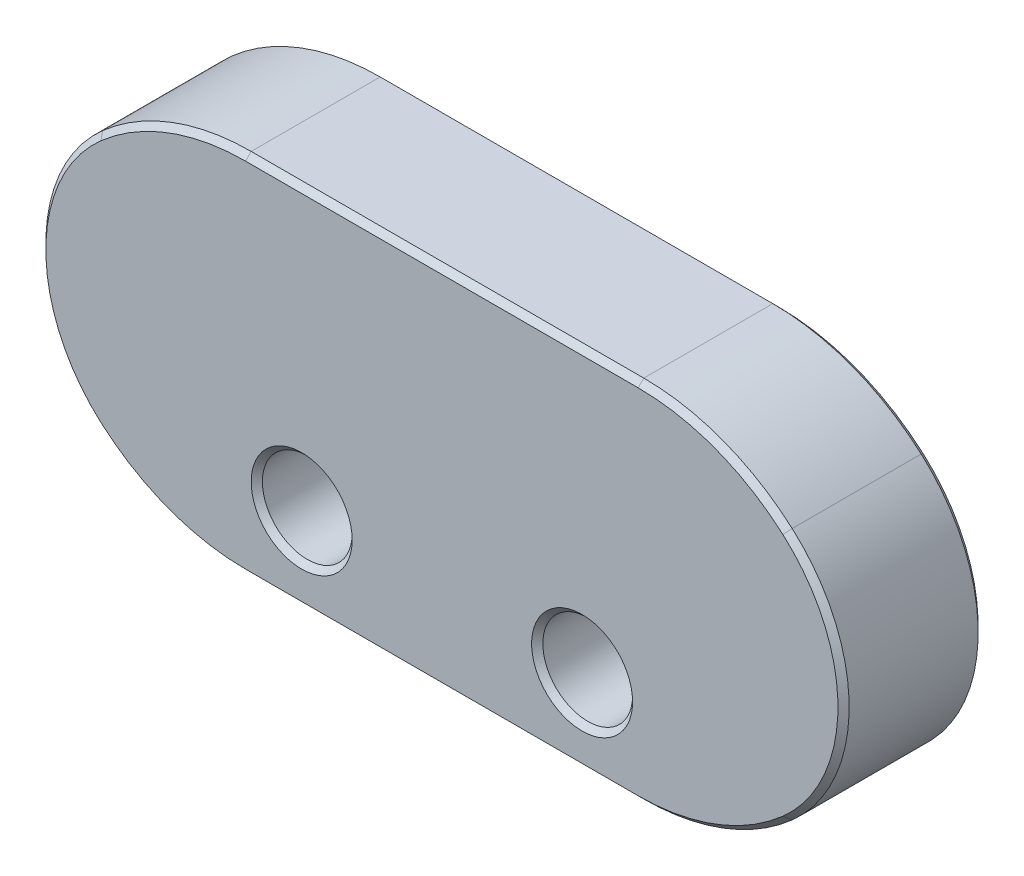
from build123d import *

# Parameters (mm, degrees)
SKETCH1_W           = 30
SKETCH1_H           = 13
BOSS_EXTRUDE1_DEPTH = 5
SKETCH2_R           = 1.6
CUT_EXTRUDE1_DEPTH  = 34.075670817
FILLET1_R           = 8
FILLET_2_R          = 6
CHAMFER_1_SIZE      = 0.2


with BuildPart() as part:
    # Sketch1 → Boss-Extrude1 (new body)
    with BuildSketch(Plane.XY):
        with Locations((15, -6.5)):
            Rectangle(SKETCH1_W, SKETCH1_H)
    extrude(amount=BOSS_EXTRUDE1_DEPTH)

    # Sketch2 → Cut-Extrude1 (cut, through all)
    with BuildSketch(Plane(origin=(0, 0, 0), x_dir=(-1, 0, 0), z_dir=(0, 0, -1))):
        with Locations((-20, -10)):
            Circle(SKETCH2_R)
        with Locations((-10, -10)):
            Circle(SKETCH2_R)
    extrude(amount=-CUT_EXTRUDE1_DEPTH, mode=Mode.SUBTRACT)

    # Fillet1
    # the kernel refuses this fillet: 8 mm, written as the material it takes off along each edge
    with BuildSketch(Plane(origin=(0, 0, -20), x_dir=(1, 0, 0), z_dir=(0, 0, 1)), Plane(origin=(0, -13, -20), x_dir=(0, 1, 0), z_dir=(0, 0, 1))) as fillet1_piece_1:
        with BuildLine():
            CenterArc((FILLET1_R, -FILLET1_R), FILLET1_R, 90, 90)
            Line((0, -FILLET1_R), (0, 0))
            Line((0, 0), (FILLET1_R, 0))
        make_face()
    extrude(amount=45, mode=Mode.SUBTRACT)
    with BuildSketch(Plane(origin=(30, -13, -20), x_dir=(0, 1, 0), z_dir=(0, 0, 1)), Plane(origin=(30, 0, -20), x_dir=(-1, 0, 0), z_dir=(0, 0, 1))) as fillet1_piece_2:
        with BuildLine():
            CenterArc((FILLET1_R, FILLET1_R), FILLET1_R, 180, 90)
            Line((0, FILLET1_R), (0, 0))
            Line((0, 0), (FILLET1_R, 0))
        make_face()
    extrude(amount=45, mode=Mode.SUBTRACT)

    # 圆角2
    fillet_2_edges = [part.edges().sort_by_distance(p)[0] for p in [
        (0.141883177, -6.5, 2.5),
        (29.858116823, -6.5, 2.5),
    ]]
    fillet(fillet_2_edges, radius=FILLET_2_R)

    # 倒角1
    chamfer_1_edges = [part.edges().sort_by_distance(p)[0] for p in [
        (21.6, -10, 5),
        (21.6, -10, 0),
        (11.6, -10, 5),
        (11.6, -10, 0),
        (15, 0, 0),
        (15, -13, 0),
        (24.828427125, -0.516685226, 0),
        (5.171572875, -12.483314774, 0),
        (15, 0, 5),
        (15, -13, 5),
        (24.828427125, -12.483314774, 5),
        (5.171572875, -0.516685226, 5),
        (24.828427125, -12.483314774, 0),
        (5.171572875, -12.483314774, 5),
        (24.828427125, -0.516685226, 5),
        (0.677124344, -6.5, 5),
        (29.322875656, -6.5, 5),
        (5.171572875, -0.516685226, 0),
        (0.677124344, -6.5, 0),
        (29.322875656, -6.5, 0),
    ]]
    chamfer(chamfer_1_edges, length=CHAMFER_1_SIZE)


solid = part.part
